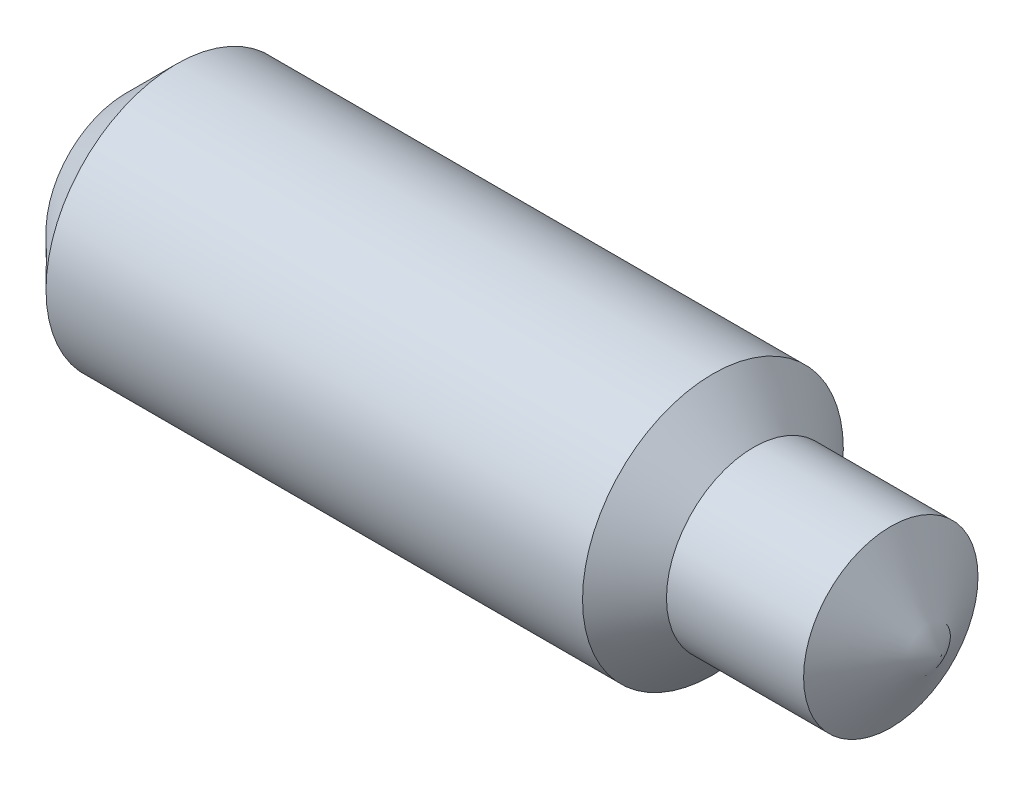
from build123d import *

# Parameters (mm, degrees)
HEADCHAMFER_SIZE = 1.5415


with BuildPart() as part:
    # Sketch1 → Base (revolve)
    with BuildSketch(Plane.XY):
        Polygon((0, 0), (0, 4), (18, 4), (19.25, 2.675), (25, 2.675), (25, 0), align=None)
    revolve(axis=Axis((-1.328405363, 0, 0), (1, 0, 0)))

    # HeadChamfer
    headchamfer_edges = [part.edges().sort_by_distance(p)[0] for p in [
        (0, -4, 0),
    ]]
    chamfer(headchamfer_edges, length=HEADCHAMFER_SIZE)

    # Sketch2 → Cut-Extrude3 (revolve, cut)
    with BuildSketch(Plane(origin=(0, 0, 0), x_dir=(1, 0, 0), z_dir=(0, 1, 0))):
        Polygon((25, 0), (23.45558803, 2.675), (23.45558803, 5), (27, 5), (27, 0), align=None)
    revolve(axis=Axis((27.052722467, 0, 0), (-1, 0, 0)), mode=Mode.SUBTRACT)


solid = part.part
